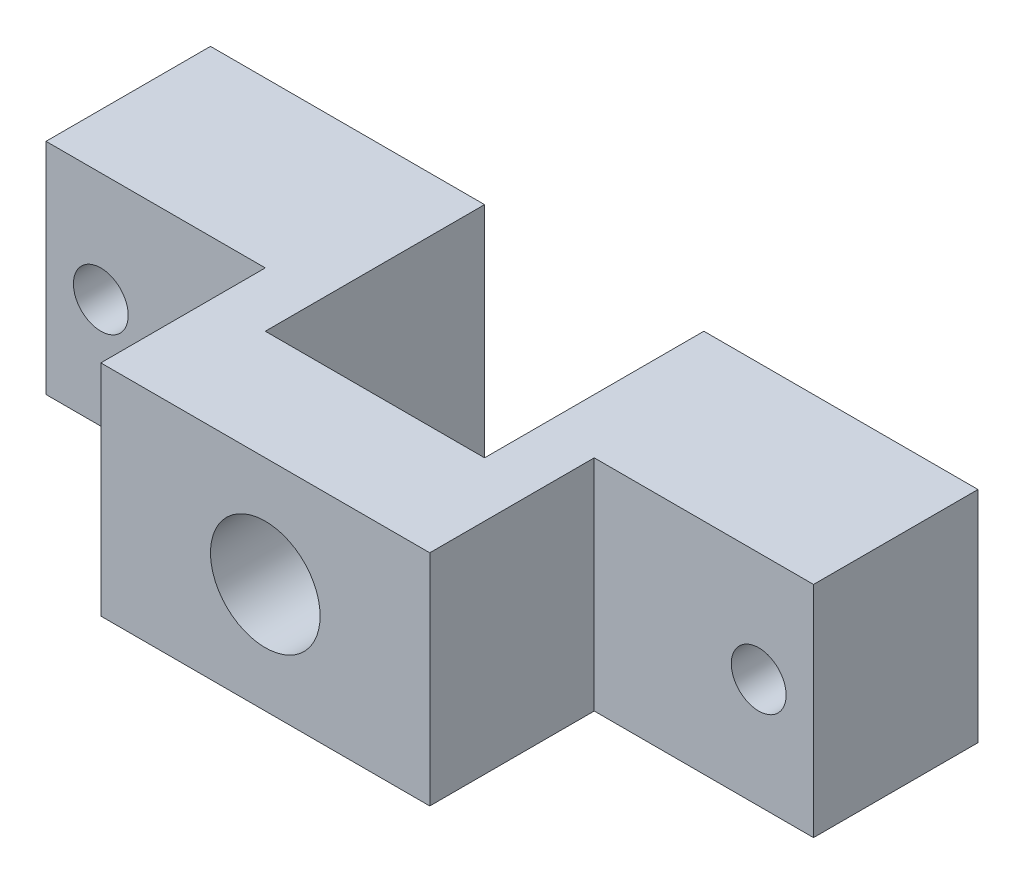
from build123d import *

# Parameters (mm, degrees)
SKETCH1_W           = 70
SKETCH1_H           = 20
SKETCH1_R           = 2.5
BOSS_EXTRUDE1_DEPTH = 15
SKETCH2_W           = 30
SKETCH2_H           = 20
BOSS_EXTRUDE2_DEPTH = 15
SKETCH4_W           = 20
SKETCH4_H           = 20
CUT_EXTRUDE1_DEPTH  = 79.74007874
SKETCH5_R           = 5
CUT_EXTRUDE2_DEPTH  = 79.74007874


with BuildPart() as part:
    # Sketch1 → Boss-Extrude1 (new body)
    with BuildSketch(Plane.XY):
        with Locations((35, 10)):
            Rectangle(SKETCH1_W, SKETCH1_H)
        with Locations((65, 10)):
            Circle(SKETCH1_R, mode=Mode.SUBTRACT)
        with Locations((5, 10)):
            Circle(SKETCH1_R, mode=Mode.SUBTRACT)
    extrude(amount=BOSS_EXTRUDE1_DEPTH)

    # Sketch2 → Boss-Extrude2 (add)
    with BuildSketch(Plane.XY.offset(15)):
        with Locations((35, 10)):
            Rectangle(SKETCH2_W, SKETCH2_H)
    extrude(amount=BOSS_EXTRUDE2_DEPTH)

    # Sketch4 → Cut-Extrude1 (cut, through all)
    with BuildSketch(Plane(origin=(0, 20, 0), x_dir=(1, 0, 0), z_dir=(0, 1, 0))):
        with Locations((35, -10)):
            Rectangle(SKETCH4_W, SKETCH4_H)
    extrude(amount=-CUT_EXTRUDE1_DEPTH, mode=Mode.SUBTRACT)

    # Sketch5 → Cut-Extrude2 (cut, through all)
    with BuildSketch(Plane.XY.offset(30)):
        with Locations((35, 10)):
            Circle(SKETCH5_R)
    extrude(amount=-CUT_EXTRUDE2_DEPTH, mode=Mode.SUBTRACT)


solid = part.part
